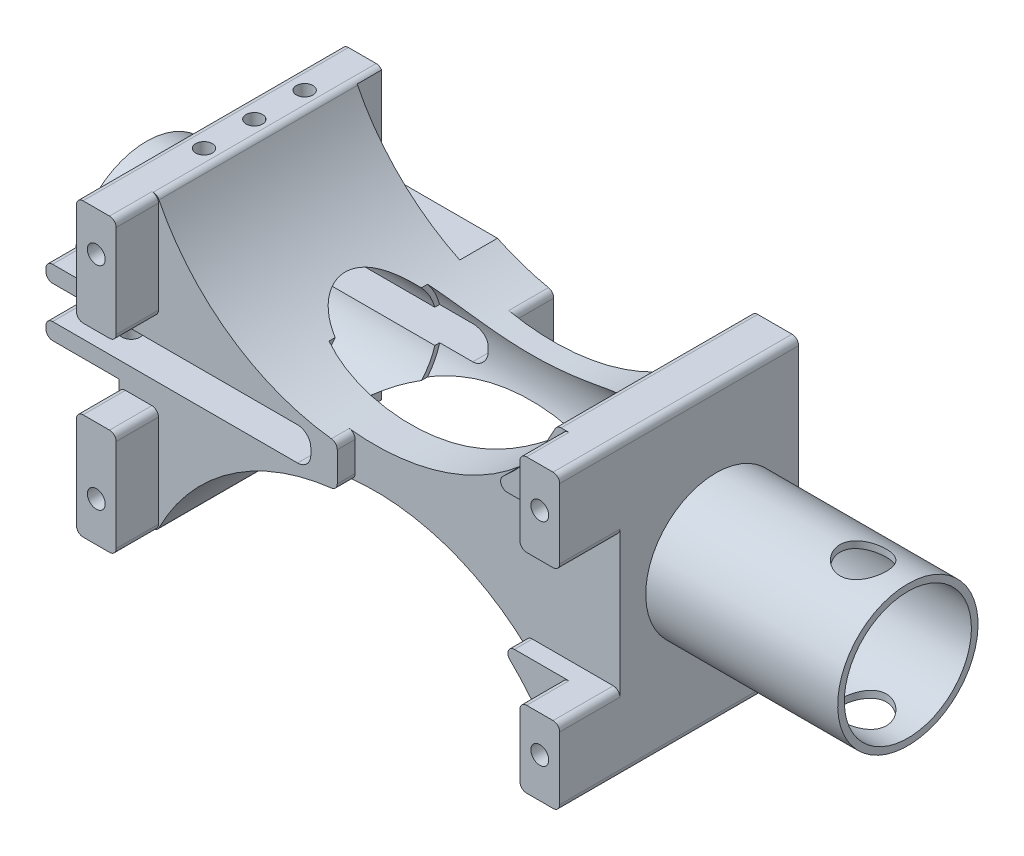
from build123d import *

# Parameters (mm, degrees)
EXTRUDE_1_DEPTH             = 40
SKETCH_3_R                  = 8.9
CUT_EXTRUDE_1_DEPTH         = 87.098780479
SKETCH_4_W                  = 29
SKETCH_4_H                  = 5
CUT_EXTRUDE_2_DEPTH         = 59.44869562
FILLET_1_R                  = 2
SKETCH_2_R                  = 9.6
CUT_EXTRUDE_3_DEPTH         = 51
CUT_EXTRUDE_5_DEPTH         = 10
EXTRUDE_START               = 13
SKETCH_7_R                  = 11
SKETCH_7_R_2                = 8.9
EXTRUDE_2_DEPTH             = 13
CHAMFER_1_SIZE              = 1.71
SKETCH_9_W                  = 21.868052594
SKETCH_9_H                  = 5
CUT_EXTRUDE_6_DEPTH         = 13
EXTRUDE_START_2             = 11
EXTRUDE_6_DEPTH             = 11
EXTRUDE_START_3             = 29
SKETCH_11_R                 = 10.6
SKETCH_11_R_2               = 9.6
EXTRUDE_7_DEPTH             = 29
CUT_EXTRUDE_7_DEPTH         = 13
CUT_EXTRUDE_7_DEPTH_BACK    = 13
SKETCH_12_R                 = 3.5
SKETCH_13_W                 = 8.6
SKETCH_13_H                 = 40
CUT_EXTRUDE_8_DEPTH         = 112.749720504
SKETCH_14_W                 = 4
SKETCH_14_H                 = 15.7
CUT_EXTRUDE_9_DEPTH         = 10
M3X0_5_1_AT_2_COUNT         = 2
M3X0_5_1_AT_2_PITCH         = 7.6
M3X0_5_1_AT_3_COUNT         = 2
M3X0_5_1_AT_3_PITCH         = 15.2
SKETCH_17_W                 = 12
SKETCH_17_H                 = 44
CUT_EXTRUDE_10_DEPTH        = 37
EXTRUDE_8_DEPTH             = 3
FILLET_2_R                  = 1
SKETCH_19_W                 = 5.4
SKETCH_19_H                 = 20
CUT_EXTRUDE_11_DEPTH        = 40
SKETCH_21_W                 = 6
SKETCH_21_H                 = 11.5
SKETCH_21_H_2               = 12.5
SKETCH_21_H_3               = 16
EXTRUDE_9_DEPTH             = 6.4
SKETCH_22_W                 = 12
SKETCH_22_H                 = 13.222454156
CUT_EXTRUDE_12_DEPTH        = 6
FILLET_3_R                  = 1
HOLE_WIZARD_M3_1_AT_2_COUNT = 2
HOLE_WIZARD_M3_1_AT_2_PITCH = 32
HOLE_WIZARD_M3_2_AT_2_COUNT = 2
HOLE_WIZARD_M3_2_AT_2_PITCH = 32
HOLE_WIZARD_M3_3_AT_2_COUNT = 2
HOLE_WIZARD_M3_3_AT_2_PITCH = 32
HOLE_WIZARD_M3_4_AT_2_COUNT = 2
HOLE_WIZARD_M3_4_AT_2_PITCH = 32
SKETCH_31_W                 = 8.6
SKETCH_31_H                 = 48.404671696
CUT_EXTRUDE_13_DEPTH        = 10
FILLET_4_R                  = 1
HOLE_WIZARD_M3_5_D          = 2.7


with BuildPart() as part:
    # 草图1 → 凸台-拉伸1 (new body)
    with BuildSketch(Plane.XY):
        with BuildLine():
            Line((-30.699337741, 22), (-36.5, 22))
            Line((-36.5, 22), (-36.5, -22))
            Line((-36.5, -22), (-30.699337741, -22))
            ThreePointArc((-30.699337741, -22), (-0.5, -3), (29.699337741, -22))
            Line((29.699337741, -22), (36.5, -22))
            Line((36.5, -22), (36.5, 22))
            Line((36.5, 22), (29.699337741, 22))
            ThreePointArc((29.699337741, 22), (-0.5, 3), (-30.699337741, 22))
        make_face()
    extrude(amount=EXTRUDE_1_DEPTH)

    # 草图3 → 切除-拉伸1 (cut, through all)
    with BuildSketch(Plane.ZY.offset(36.5)):
        with Locations(Location((22.8, 0, 0), (0, 0, 270))):
            Circle(SKETCH_3_R)
    extrude(amount=-CUT_EXTRUDE_1_DEPTH, mode=Mode.SUBTRACT)

    # 草图4 → 切除-拉伸2 (cut, through all)
    with BuildSketch(Plane.XY.offset(40)):
        with Locations((-22, 0)):
            Rectangle(SKETCH_4_W, SKETCH_4_H)
    extrude(amount=-CUT_EXTRUDE_2_DEPTH, mode=Mode.SUBTRACT)

    # 圆角1
    fillet_1_edges = [part.edges().sort_by_distance(p)[0] for p in [
        (-7.5, 2.5, 7.129168699),
        (-7.5, 2.5, 35.670831301),
        (-7.5, -2.5, 35.670831301),
        (-7.5, -2.5, 7.129168699),
    ]]
    fillet(fillet_1_edges, radius=FILLET_1_R)

    # 草图2 → 切除-拉伸3 (cut)
    with BuildSketch(Plane(origin=(36.5, 0, 0), x_dir=(0, 0, -1), z_dir=(1, 0, 0))):
        with Locations(Location((-22.8, 0, 0), (0, 0, 90))):
            Circle(SKETCH_2_R)
    extrude(amount=-CUT_EXTRUDE_3_DEPTH, mode=Mode.SUBTRACT)

    # 草图6 → 切除-拉伸5 (cut)
    with BuildSketch(Plane(origin=(0, 0, 0), x_dir=(-1, 0, 0), z_dir=(0, 0, -1))):
        with BuildLine():
            Line((30.5, 22), (30.5, 8.3))
            ThreePointArc((30.5, 8.3), (31.5, 7.3), (30.5, 6.3))
            Line((30.5, 6.3), (11.319995146, 6.3))
            Line((11.319995146, 6.3), (11.319995146, 22))
            Line((11.319995146, 22), (30.5, 22))
        make_face()
        with BuildLine():
            Line((11.319995146, -22), (30.5, -22))
            Line((30.5, -22), (30.5, -8.3))
            ThreePointArc((30.5, -8.3), (31.5, -7.3), (30.5, -6.3))
            Line((30.5, -6.3), (11.319995146, -6.3))
            Line((11.319995146, -6.3), (11.319995146, -22))
        make_face()
    extrude(amount=-CUT_EXTRUDE_5_DEPTH, mode=Mode.SUBTRACT)

    # 草图7 → 凸台-拉伸2 (add)
    with BuildSketch(Plane.ZY.offset(36.5).offset(EXTRUDE_START)):
        with Locations(Location((22.8, 0, 0), (0, 0, 13.136558787))):
            Circle(SKETCH_7_R)
        with Locations(Location((22.8, 0, 0), (0, 0, 270))):
            Circle(SKETCH_7_R_2, mode=Mode.SUBTRACT)
    extrude(amount=-EXTRUDE_2_DEPTH)

    # 倒角1
    chamfer_1_edges = [part.edges().sort_by_distance(p)[0] for p in [
        (-49.5, 8.9, 22.8),
    ]]
    chamfer(chamfer_1_edges, length=CHAMFER_1_SIZE)

    # 草图9 → 切除-拉伸6 (cut)
    with BuildSketch(Plane(origin=(-36.5, 0, 0), x_dir=(0, 0, -1), z_dir=(1, 0, 0))):
        with Locations((-30.41135016, 0)):
            Rectangle(SKETCH_9_W, SKETCH_9_H)
    extrude(amount=-CUT_EXTRUDE_6_DEPTH, mode=Mode.SUBTRACT)

    # 草图10 → 凸台-拉伸6 (add)
    with BuildSketch(Plane.ZY.offset(36.5).offset(EXTRUDE_START_2)):
        with BuildLine():
            Line((40, 5), (32.597958971, 5))
            ThreePointArc((32.597958971, 5), (33.130951895, 3.777755014), (33.512142643, 2.5))
            Line((33.512142643, 2.5), (40, 2.5))
            Line((40, 2.5), (40, 5))
        make_face()
        with BuildLine():
            Line((40, -5), (32.597958971, -5))
            ThreePointArc((32.597958971, -5), (33.130951895, -3.777755014), (33.512142643, -2.5))
            Line((33.512142643, -2.5), (40, -2.5))
            Line((40, -2.5), (40, -5))
        make_face()
    extrude(amount=-EXTRUDE_6_DEPTH)

    # 草图11 → 凸台-拉伸7 (add)
    with BuildSketch(Plane(origin=(36.5, 0, 0), x_dir=(0, 0, -1), z_dir=(1, 0, 0)).offset(EXTRUDE_START_3)):
        with Locations(Location((-22.8, 0, 0), (0, 0, 270))):
            Circle(SKETCH_11_R)
        with Locations(Location((-22.8, 0, 0), (0, 0, 90))):
            Circle(SKETCH_11_R_2, mode=Mode.SUBTRACT)
    extrude(amount=-EXTRUDE_7_DEPTH)

    # 草图12 → 切除-拉伸7 (cut, two sides: drawn at the far end of the back side and taken through both)
    with BuildSketch(Plane(origin=(0, 0, 0), x_dir=(1, 0, 0), z_dir=(0, 1, 0)).offset(-CUT_EXTRUDE_7_DEPTH_BACK)):
        with Locations((58.75, -22.8)):
            Circle(SKETCH_12_R)
    extrude(amount=CUT_EXTRUDE_7_DEPTH + CUT_EXTRUDE_7_DEPTH_BACK, mode=Mode.SUBTRACT)

    # 草图13 → 切除-拉伸8 (cut, through all)
    with BuildSketch(Plane.ZY.offset(36.5)):
        Rectangle(SKETCH_13_W, SKETCH_13_H)
    extrude(amount=-CUT_EXTRUDE_8_DEPTH, mode=Mode.SUBTRACT)

    # 草图14 → 切除-拉伸9 (cut)
    with BuildSketch(Plane.ZY.offset(36.5)):
        with Locations((4.3, -14.15)):
            Rectangle(SKETCH_14_W, SKETCH_14_H)
        with Locations((4.3, 14.15)):
            Rectangle(SKETCH_14_W, SKETCH_14_H)
    extrude(amount=-CUT_EXTRUDE_9_DEPTH, mode=Mode.SUBTRACT)


with BuildPart() as cut_extrude_9_piece_1:
    # of the separate pieces the step leaves, piece 1, a body of its own (cut_extrude_9_pieces)
    add(part.part.solids().sort_by_distance((-47.79, 2.5, 31.341662602))[0])

    # 草图16 → M3x0.5 螺纹孔1 (revolve, cut)
    with BuildSketch(Plane(origin=(-33.227474522, 22, 15.2), x_dir=(0, 0, 1), z_dir=(1, 0, 0))):
        Polygon((0, 0), (0, 6.751075774), (1.25, 6), (1.25, 0), align=None)
    m3x0_5_1 = revolve(axis=Axis((-33.227474522, 28.35, 15.2), (0, -1, 0)), mode=Mode.SUBTRACT)

    # M3x0.5 螺纹孔1 at 2: M3x0.5 螺纹孔1 ×2
    with Locations(*[(0, 0, i * M3X0_5_1_AT_2_PITCH) for i in range(1, M3X0_5_1_AT_2_COUNT)]):
        add(m3x0_5_1, mode=Mode.SUBTRACT)

    # M3x0.5 螺纹孔1 at 3: M3x0.5 螺纹孔1 ×2
    with Locations(*[(0, 0, i * M3X0_5_1_AT_3_PITCH) for i in range(1, M3X0_5_1_AT_3_COUNT)]):
        add(m3x0_5_1, mode=Mode.SUBTRACT)

    # 草图17 → 切除-拉伸10 (cut)
    with BuildSketch(Plane(origin=(36.5, 0, 0), x_dir=(0, 0, -1), z_dir=(1, 0, 0))):
        with Locations((-4.3, 0)):
            Rectangle(SKETCH_17_W, SKETCH_17_H)
    extrude(amount=-CUT_EXTRUDE_10_DEPTH, mode=Mode.SUBTRACT)

    # 草图18 → 凸台-拉伸8 (add)
    with BuildSketch(Plane(origin=(0, 0, 10.3), x_dir=(-1, 0, 0), z_dir=(0, 0, -1))):
        with BuildLine():
            Line((-26.8, 17.084542241), (-26.8, -17.084542241))
            ThreePointArc((-26.8, -17.084542241), (-24.906809205, -14.665530782), (-22.8, -12.430101787))
            Line((-22.8, -12.430101787), (-22.8, 12.430101787))
            ThreePointArc((-22.8, 12.430101787), (-24.906809205, 14.665530782), (-26.8, 17.084542241))
        make_face()
    extrude(amount=EXTRUDE_8_DEPTH)

    # 圆角2
    # the kernel refuses this fillet: 1 mm, written as the material it takes off along each edge
    with BuildSketch(Plane(origin=(22.8, 12.430101787, 10.3), x_dir=(0.7141933511372105, 0.6999484675255752, 0), z_dir=(0, 0, -1))) as fillet_2_piece_1:
        with BuildLine():
            CenterArc((0.420145178, 0.999980912), FILLET_2_R, 224.422869689, 45.223120036)
            Line((-0.294048173, 0.300032445), (0, 0))
            ThreePointArc((0, 0), (0.206983286, 0.00063944), (0.413966573, 0))
        make_face()
    extrude(amount=4.050249363, mode=Mode.SUBTRACT)
    with BuildSketch(Plane(origin=(26.8, 17.084542241, 10.3), x_dir=(-0.6139474926799818, -0.7893468668665022, 0), z_dir=(0, 0, -1))) as fillet_2_piece_2:
        with BuildLine():
            CenterArc((2.913314458, -0.999081823), FILLET_2_R, 92.455466605, 139.669050412)
            Line((2.299366965, -1.78842869), (0, 0))
            ThreePointArc((0, 0), (1.435235799, -0.030758924), (2.870471598, 0))
        make_face()
    extrude(amount=10.28249855, mode=Mode.SUBTRACT)
    with BuildSketch(Plane(origin=(26.8, -17.084542241, 10.3), x_dir=(-0.6139474926799804, 0.7893468668665035, 0), z_dir=(0, 0, -1))) as fillet_2_piece_3:
        with BuildLine():
            CenterArc((2.913314458, 0.999081823), FILLET_2_R, 127.875482983, 139.669050412)
            Line((2.299366965, 1.78842869), (0, 0))
            ThreePointArc((0, 0), (1.435235799, 0.030758924), (2.870471598, 0))
        make_face()
    extrude(amount=10.28249855, mode=Mode.SUBTRACT)
    with BuildSketch(Plane(origin=(22.8, -12.430101787, 10.3), x_dir=(0.7141933511372169, -0.6999484675255686, 0), z_dir=(0, 0, -1))) as fillet_2_piece_4:
        with BuildLine():
            CenterArc((0.420145178, -0.999980912), FILLET_2_R, 90.354010275, 45.223120036)
            Line((-0.294048173, -0.300032445), (0, 0))
            ThreePointArc((0, 0), (0.206983286, -0.00063944), (0.413966573, 0))
        make_face()
    extrude(amount=4.050249363, mode=Mode.SUBTRACT)

    # 草图19 → 切除-拉伸11 (cut)
    with BuildSketch(Plane(origin=(36.5, 0, 0), x_dir=(0, 0, -1), z_dir=(1, 0, 0))):
        with Locations((-40, -0.5)):
            Rectangle(SKETCH_19_W, SKETCH_19_H)
    extrude(amount=-CUT_EXTRUDE_11_DEPTH, mode=Mode.SUBTRACT)

    # 草图21 → 凸台-拉伸9 (add)
    with BuildSketch(Plane.XY.offset(40)):
        with Locations((33.5, -16.25)):
            Rectangle(SKETCH_21_W, SKETCH_21_H)
        with Locations((33.5, 15.75)):
            Rectangle(SKETCH_21_W, SKETCH_21_H_2)
        with Locations((-33.5, 14)):
            Rectangle(SKETCH_21_W, SKETCH_21_H_3)
        with Locations((-33.5, -14)):
            Rectangle(SKETCH_21_W, SKETCH_21_H_3)
    extrude(amount=EXTRUDE_9_DEPTH)

    # 草图22 → 切除-拉伸12 (cut)
    with BuildSketch(Plane(origin=(0, 0, 4.3), x_dir=(-1, 0, 0), z_dir=(0, 0, -1))):
        with Locations((0.5, 0)):
            Rectangle(SKETCH_22_W, SKETCH_22_H)
    extrude(amount=-CUT_EXTRUDE_12_DEPTH, mode=Mode.SUBTRACT)

    # 圆角3
    # the kernel refuses this fillet: 1 mm, written as the material it takes off along each edge
    with BuildSketch(Plane(origin=(-36.5, 22, 3.8), x_dir=(1, 0, 0), z_dir=(0, 0, 1))) as fillet_3_piece_1:
        with BuildLine():
            CenterArc((FILLET_3_R, -FILLET_3_R), FILLET_3_R, 90, 90)
            Line((0, -FILLET_3_R), (0, 0))
            Line((0, 0), (FILLET_3_R, 0))
        make_face()
    extrude(amount=45.1, mode=Mode.SUBTRACT)
    with BuildSketch(Plane(origin=(29.699337741, 22, 8.743169316), x_dir=(1, 0, 0), z_dir=(0, 0, 1))) as fillet_3_piece_2:
        with BuildLine():
            CenterArc((0.622732274, -1), FILLET_3_R, 90, 63.302798551)
            ThreePointArc((-0.27066106, -0.550724638), (-0.134069507, -0.275982066), (0, 0))
            Line((0, 0), (0.622732274, 0))
        make_face()
    extrude(amount=32.813661369, mode=Mode.SUBTRACT)
    with BuildSketch(Plane(origin=(-47.5, 5, 42.5), x_dir=(1, 0, 0), z_dir=(0, 0, -1))) as fillet_3_piece_3_section:
        with BuildLine():
            CenterArc((FILLET_3_R, FILLET_3_R), FILLET_3_R, 180, 90)
            Line((0, FILLET_3_R), (0, 0))
            Line((0, 0), (FILLET_3_R, 0))
        make_face()
    fillet_3_piece_3 = extrude(amount=12.402041029, mode=Mode.PRIVATE)
    fillet_3_piece_3 = fillet_3_piece_3 - Plane(origin=(-47.272277586, 0, 22.8), x_dir=(0, 0.22727272727366457, 0.9738311493465336), z_dir=(-1, 0, 0)) * Cylinder(11, 29, mode=Mode.PRIVATE)
    add(fillet_3_piece_3, mode=Mode.SUBTRACT)
    with BuildSketch(Plane(origin=(-47.5, 2.5, 31.012142643), x_dir=(0, 1, 0), z_dir=(0, 0, 1))) as fillet_3_piece_4_section:
        with BuildLine():
            CenterArc((FILLET_3_R, -FILLET_3_R), FILLET_3_R, 90, 90)
            Line((0, -FILLET_3_R), (0, 0))
            Line((0, 0), (FILLET_3_R, 0))
        make_face()
    fillet_3_piece_4 = extrude(amount=11.487857357, mode=Mode.PRIVATE)
    fillet_3_piece_4 = fillet_3_piece_4 - Plane(origin=(-47.274402551, 0, 22.8), x_dir=(0, 0.22727272727366457, 0.9738311493465336), z_dir=(-1, 0, 0)) * Cylinder(11, 27, mode=Mode.PRIVATE)
    add(fillet_3_piece_4, mode=Mode.SUBTRACT)
    with BuildSketch(Plane(origin=(-47.5, -2.5, 31.012142643), x_dir=(1, 0, 0), z_dir=(0, 0, 1))) as fillet_3_piece_5_section:
        with BuildLine():
            CenterArc((FILLET_3_R, -FILLET_3_R), FILLET_3_R, 90, 90)
            Line((0, -FILLET_3_R), (0, 0))
            Line((0, 0), (FILLET_3_R, 0))
        make_face()
    fillet_3_piece_5 = extrude(amount=11.487857357, mode=Mode.PRIVATE)
    fillet_3_piece_5 = fillet_3_piece_5 - Plane(origin=(-47.274402734, 0, 22.8), x_dir=(0, 0.22727272727366457, 0.9738311493465336), z_dir=(-1, 0, 0)) * Cylinder(11, 27, mode=Mode.PRIVATE)
    add(fillet_3_piece_5, mode=Mode.SUBTRACT)
    with BuildSketch(Plane(origin=(-47.5, -5, 42.5), x_dir=(0, 1, 0), z_dir=(0, 0, -1))) as fillet_3_piece_6_section:
        with BuildLine():
            CenterArc((FILLET_3_R, FILLET_3_R), FILLET_3_R, 180, 90)
            Line((0, FILLET_3_R), (0, 0))
            Line((0, 0), (FILLET_3_R, 0))
        make_face()
    fillet_3_piece_6 = extrude(amount=12.402041029, mode=Mode.PRIVATE)
    fillet_3_piece_6 = fillet_3_piece_6 - Plane(origin=(-47.272276959, 0, 22.8), x_dir=(0, 0.22727272727366457, 0.9738311493465336), z_dir=(-1, 0, 0)) * Cylinder(11, 29, mode=Mode.PRIVATE)
    add(fillet_3_piece_6, mode=Mode.SUBTRACT)
    with BuildSketch(Plane(origin=(20.624630174, -10.5, 46.625891704), x_dir=(1, 0, 0), z_dir=(0, 0, -1))) as fillet_3_piece_7:
        with BuildLine():
            CenterArc((2.650356682, 1), FILLET_3_R, 133.561284481, 136.438715519)
            ThreePointArc((1.961226628, 1.724637681), (0.997426318, 0.843199398), (0, 0))
            Line((0, 0), (2.650356682, 0))
        make_face()
    extrude(amount=9.325891704, mode=Mode.SUBTRACT)
    with BuildSketch(Plane(origin=(19.330532015, 9.5, 47.116372315), x_dir=(1, 0, 0), z_dir=(0, 0, -1))) as fillet_3_piece_8:
        with BuildLine():
            CenterArc((2.846548926, -1), FILLET_3_R, 90, 138.905212005)
            ThreePointArc((2.189242232, -1.753623188), (1.112983261, -0.853888093), (0, 0))
            Line((0, 0), (2.846548926, 0))
        make_face()
    extrude(amount=9.816372315, mode=Mode.SUBTRACT)
    with BuildSketch(Plane(origin=(-3.5, -3.134598759, 42.25482535), x_dir=(0, 1, 0), z_dir=(0, 0, -1))) as fillet_3_piece_9:
        with BuildLine():
            CenterArc((0.90193014, -1), FILLET_3_R, 90, 83.342037191)
            ThreePointArc((-0.091325842, -0.884057971), (-0.04273101, -0.442331861), (0, 0))
            Line((0, 0), (0.90193014, 0))
        make_face()
    extrude(amount=4.95482535, mode=Mode.SUBTRACT)
    with BuildSketch(Plane(origin=(-3.5, 3.134598759, 42.25482535), x_dir=(0, -1, 0), z_dir=(0, 0, -1))) as fillet_3_piece_10:
        with BuildLine():
            CenterArc((0.90193014, 1), FILLET_3_R, 186.657962809, 83.342037191)
            ThreePointArc((-0.091325842, 0.884057971), (-0.04273101, 0.442331861), (0, 0))
            Line((0, 0), (0.90193014, 0))
        make_face()
    extrude(amount=4.95482535, mode=Mode.SUBTRACT)
    with BuildSketch(Plane(origin=(36.5, -10.5, 48.9), x_dir=(-1, 0, 0), z_dir=(0, 0, -1)), Plane(origin=(36.5, 9.5, 37.3), x_dir=(-1, 0, 0), z_dir=(0, 0, 1))) as fillet_3_piece_11:
        with BuildLine():
            CenterArc((FILLET_3_R, -FILLET_3_R), FILLET_3_R, 90, 90)
            Line((0, -FILLET_3_R), (0, 0))
            Line((0, 0), (FILLET_3_R, 0))
        make_face()
    extrude(amount=11.6, mode=Mode.SUBTRACT)
    with BuildSketch(Plane(origin=(30.5, -10.5, 40), x_dir=(1, 0, 0), z_dir=(0, 0, 1)), Plane(origin=(-30.5, 6, 40), x_dir=(-1, 0, 0), z_dir=(0, 0, 1)), Plane(origin=(-30.5, -6, 40), x_dir=(0, -1, 0), z_dir=(0, 0, 1))) as fillet_3_piece_12:
        with BuildLine():
            CenterArc((FILLET_3_R, -FILLET_3_R), FILLET_3_R, 90, 90)
            Line((0, -FILLET_3_R), (0, 0))
            Line((0, 0), (FILLET_3_R, 0))
        make_face()
    extrude(amount=8.9, mode=Mode.SUBTRACT)
    with BuildSketch(Plane(origin=(30.5, -22, 40), x_dir=(1, 0, 0), z_dir=(0, 0, 1)), Plane(origin=(30.5, 22, 40), x_dir=(0, -1, 0), z_dir=(0, 0, 1)), Plane(origin=(30.5, 9.5, 40), x_dir=(1, 0, 0), z_dir=(0, 0, 1)), Plane(origin=(-30.5, 22, 40), x_dir=(-1, 0, 0), z_dir=(0, 0, 1)), Plane(origin=(-36.5, 6, 40), x_dir=(1, 0, 0), z_dir=(0, 0, 1)), Plane(origin=(-30.5, -22, 40), x_dir=(0, 1, 0), z_dir=(0, 0, 1)), Plane(origin=(-36.5, -6, 40), x_dir=(0, -1, 0), z_dir=(0, 0, 1))) as fillet_3_piece_13:
        with BuildLine():
            CenterArc((FILLET_3_R, FILLET_3_R), FILLET_3_R, 180, 90)
            Line((0, FILLET_3_R), (0, 0))
            Line((0, 0), (FILLET_3_R, 0))
        make_face()
    extrude(amount=8.9, mode=Mode.SUBTRACT)
    with BuildSketch(Plane(origin=(-6.5, 3.541693005, 10.3), x_dir=(0, -1, 0), z_dir=(0, 0, -1))) as fillet_3_piece_14:
        with BuildLine():
            CenterArc((0.824084868, 1), FILLET_3_R, 191.706509793, 78.293490207)
            ThreePointArc((-0.155114896, 0.797101449), (-0.075142101, 0.399020748), (0, 0))
            Line((0, 0), (0.824084868, 0))
        make_face()
    extrude(amount=8.06021217, mode=Mode.SUBTRACT)
    with BuildSketch(Plane(origin=(-6.5, -3.541693005, 10.3), x_dir=(0, 1, 0), z_dir=(0, 0, -1))) as fillet_3_piece_15:
        with BuildLine():
            CenterArc((0.824084868, -1), FILLET_3_R, 90, 78.293490207)
            ThreePointArc((-0.155114896, -0.797101449), (-0.075142101, -0.399020748), (0, 0))
            Line((0, 0), (0.824084868, 0))
        make_face()
    extrude(amount=8.06021217, mode=Mode.SUBTRACT)
    with BuildSketch(Plane(origin=(36.5, -22, 7.8), x_dir=(-1, 0, 0), z_dir=(0, 0, 1)), Plane(origin=(36.5, 22, 48.9), x_dir=(-1, 0, 0), z_dir=(0, 0, -1))) as fillet_3_piece_16:
        with BuildLine():
            CenterArc((FILLET_3_R, -FILLET_3_R), FILLET_3_R, 90, 90)
            Line((0, -FILLET_3_R), (0, 0))
            Line((0, 0), (FILLET_3_R, 0))
        make_face()
    extrude(amount=41.1, mode=Mode.SUBTRACT)
    with BuildSketch(Plane(origin=(29.699337741, -22, 8.743169316), x_dir=(1, 0, 0), z_dir=(0, 0, 1))) as fillet_3_piece_17:
        with BuildLine():
            CenterArc((0.622732274, 1), FILLET_3_R, 206.697201449, 63.302798551)
            ThreePointArc((-0.27066106, 0.550724638), (-0.134069507, 0.275982066), (0, 0))
            Line((0, 0), (0.622732274, 0))
        make_face()
    extrude(amount=32.813661369, mode=Mode.SUBTRACT)

    # 草图24 → M3 螺纹孔1 (revolve, cut)
    with BuildSketch(Plane(origin=(-33.5, -16, 46.4), x_dir=(0, -1, 0), z_dir=(1, 0, 0))):
        Polygon((0, 0), (0, 8.311161836), (1.35, 7.5), (1.35, 0), align=None)
    hole_wizard_m3_1 = revolve(axis=Axis((-33.5, -16, 52.75), (0, 0, -1)), mode=Mode.SUBTRACT)

    # M3 螺纹孔1 at 2: M3 螺纹孔1 ×2
    with Locations(*[(0, i * HOLE_WIZARD_M3_1_AT_2_PITCH, 0) for i in range(1, HOLE_WIZARD_M3_1_AT_2_COUNT)]):
        add(hole_wizard_m3_1, mode=Mode.SUBTRACT)

    # 草图26 → M3 螺纹孔2 (revolve, cut)
    with BuildSketch(Plane(origin=(33.5, 16, 46.4), x_dir=(0, -1, 0), z_dir=(1, 0, 0))):
        Polygon((0, 0), (0, 8.311161836), (1.35, 7.5), (1.35, 0), align=None)
    hole_wizard_m3_2 = revolve(axis=Axis((33.5, 16, 52.75), (0, 0, -1)), mode=Mode.SUBTRACT)

    # M3 螺纹孔2 at 2: M3 螺纹孔2 ×2
    with Locations(*[(0, -i * HOLE_WIZARD_M3_2_AT_2_PITCH, 0) for i in range(1, HOLE_WIZARD_M3_2_AT_2_COUNT)]):
        add(hole_wizard_m3_2, mode=Mode.SUBTRACT)

    # 草图28 → M3 螺纹孔3 (revolve, cut)
    with BuildSketch(Plane(origin=(-33.503221881, 16, 6.3), x_dir=(0, 1, 0), z_dir=(1, 0, 0))):
        Polygon((0, 0), (0, 8.311161836), (1.35, 7.5), (1.35, 0), align=None)
    hole_wizard_m3_3 = revolve(axis=Axis((-33.503221881, 16, -0.05), (0, 0, 1)), mode=Mode.SUBTRACT)

    # M3 螺纹孔3 at 2: M3 螺纹孔3 ×2
    with Locations(*[(0, -i * HOLE_WIZARD_M3_3_AT_2_PITCH, 0) for i in range(1, HOLE_WIZARD_M3_3_AT_2_COUNT)]):
        add(hole_wizard_m3_3, mode=Mode.SUBTRACT)

    # 草图30 → M3 螺纹孔4 (revolve, cut)
    with BuildSketch(Plane(origin=(33.5, 16, 10.3), x_dir=(0, 1, 0), z_dir=(1, 0, 0))):
        Polygon((0, 0), (0, 8.311161836), (1.35, 7.5), (1.35, 0), align=None)
    hole_wizard_m3_4 = revolve(axis=Axis((33.5, 16, 3.95), (0, 0, 1)), mode=Mode.SUBTRACT)

    # M3 螺纹孔4 at 2: M3 螺纹孔4 ×2
    with Locations(*[(0, -i * HOLE_WIZARD_M3_4_AT_2_PITCH, 0) for i in range(1, HOLE_WIZARD_M3_4_AT_2_COUNT)]):
        add(hole_wizard_m3_4, mode=Mode.SUBTRACT)

    # 镜向1: M3x0.5 螺纹孔1 across plane
    add(m3x0_5_1.mirror(Plane.ZX), mode=Mode.SUBTRACT)

    # 镜向1 copy 1 sketch → 镜向1 copy 1 (revolve, cut)
    with BuildSketch(Plane(origin=(-33.227474522, -22, 22.8), x_dir=(0, 0, 1), z_dir=(1, 0, 0))):
        Polygon((0, 0), (0, -6.751075774), (1.25, -6), (1.25, 0), align=None)
    revolve(axis=Axis((-33.227474522, -28.35, 22.8), (0, -1, 0)), mode=Mode.SUBTRACT)

    # 镜向1 copy 2 sketch → 镜向1 copy 2 (revolve, cut)
    with BuildSketch(Plane(origin=(-33.227474522, -22, 30.4), x_dir=(0, 0, 1), z_dir=(1, 0, 0))):
        Polygon((0, 0), (0, -6.751075774), (1.25, -6), (1.25, 0), align=None)
    revolve(axis=Axis((-33.227474522, -28.35, 30.4), (0, -1, 0)), mode=Mode.SUBTRACT)

    # 圆角4
    fillet_4_edges = [cut_extrude_9_piece_1.edges().sort_by_distance(p)[0] for p in [
        (-30.699337741, 22, 23.15),
        (-36.5, -22, 26.35),
        (-30.699337741, -22, 23.15),
    ]]
    fillet(fillet_4_edges, radius=FILLET_4_R)

    # M3 螺纹孔5 (through all)
    with Locations(Plane(origin=(0, 5, 0), x_dir=(1, 0, 0), z_dir=(0, 1, 0))):
        with Locations((-39.2, -35.45), (-44.7, -35.45)):
            Hole(HOLE_WIZARD_M3_5_D / 2)


with BuildPart() as cut_extrude_9_piece_2:
    # of the separate pieces the step leaves, piece 2, a body of its own (cut_extrude_9_pieces)
    add(part.part.solids().sort_by_distance((-30.5, 21.591948484, 2.3))[0])


with BuildPart() as cut_extrude_9_piece_3:
    # of the separate pieces the step leaves, piece 3, a body of its own (cut_extrude_9_pieces)
    add(part.part.solids().sort_by_distance((-30.699337741, -22, 0))[0])


with BuildPart() as cut_extrude_13_tool:
    # 草图31 → 切除-拉伸13 (new body)
    with BuildSketch(Plane.ZY.offset(36.5)):
        Rectangle(SKETCH_31_W, SKETCH_31_H)
    extrude(amount=-CUT_EXTRUDE_13_DEPTH)


with BuildPart() as cut_extrude_9_piece_2_1:
    add(cut_extrude_9_piece_2.part)

    # 切除-拉伸13: cut by cut_extrude_13_tool
    add(cut_extrude_13_tool.part, mode=Mode.SUBTRACT)


with BuildPart() as cut_extrude_9_piece_3_1:
    add(cut_extrude_9_piece_3.part)

    # 切除-拉伸13: cut by cut_extrude_13_tool
    add(cut_extrude_13_tool.part, mode=Mode.SUBTRACT)


solid = cut_extrude_9_piece_1.part
